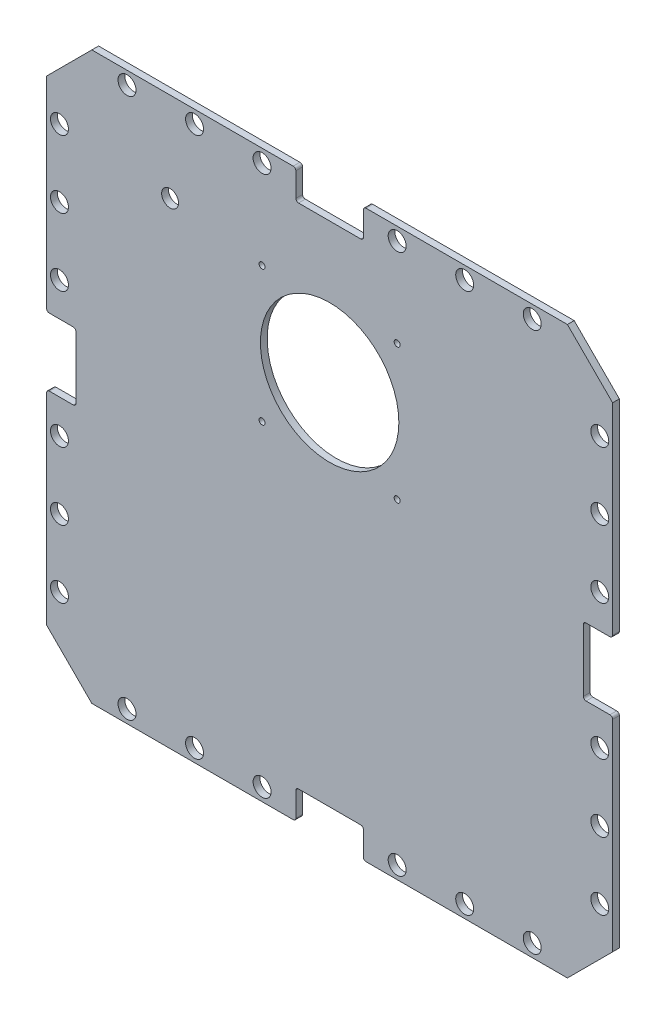
from build123d import *

# Parameters (mm, degrees)
SKETCH1_R             = 3.379999993
SKETCH1_R_2           = 3.379999996
SKETCH1_R_3           = 3.379999998
SKETCH1_R_4           = 1.13
SKETCH1_R_5           = 3.175
SKETCH1_R_6           = 3.38
SKETCH1_R_7           = 26.035
BOSS_EXTRUDE1_DEPTH   = 2.54
F_4_40_TAPPED_HOLE1_D = 2.2606
FILLET1_R             = 1


with BuildPart() as part:
    # Sketch1 → Boss-Extrude1 (new body)
    with BuildSketch(Plane.XY):
        Polygon((93.726, 0), (16.997849999, 0), (0, -16.997849999), (0, -93.726000007), (11, -93.726000007), (11, -119.126000007), (0, -119.126000007), (0, -195.854150007), (16.997849999, -212.852000007), (93.726000007, -212.852000007), (93.726000007, -201.852000007), (119.126000007, -201.852000007), (119.126000007, -212.852000007), (195.854150007, -212.852000007), (212.852000007, -195.854150007), (212.852000007, -119.126), (201.852000007, -119.126), (201.852000007, -93.726), (212.852000007, -93.726), (212.852000007, -16.997849999), (195.854150007, 0), (119.126, 0), (119.126, -11), (93.726, -11), align=None)
        with Locations((30.226, -208.026000005)):
            Circle(SKETCH1_R, mode=Mode.SUBTRACT)
        with Locations((4.825999998, -182.626000003)):
            Circle(SKETCH1_R_2, mode=Mode.SUBTRACT)
        with Locations((55.626, -208.026000005)):
            Circle(SKETCH1_R, mode=Mode.SUBTRACT)
        with Locations((81.026, -208.026000005)):
            Circle(SKETCH1_R, mode=Mode.SUBTRACT)
        with Locations((4.825999998, -157.226000003)):
            Circle(SKETCH1_R_2, mode=Mode.SUBTRACT)
        with Locations((4.825999998, -131.826000003)):
            Circle(SKETCH1_R_2, mode=Mode.SUBTRACT)
        with Locations((131.826, -208.026000005)):
            Circle(SKETCH1_R, mode=Mode.SUBTRACT)
        with Locations((157.226, -208.026000005)):
            Circle(SKETCH1_R, mode=Mode.SUBTRACT)
        with Locations((182.626, -208.026000005)):
            Circle(SKETCH1_R, mode=Mode.SUBTRACT)
        with Locations((208.026000002, -182.626000003)):
            Circle(SKETCH1_R_3, mode=Mode.SUBTRACT)
        with Locations((208.026000002, -157.226000003)):
            Circle(SKETCH1_R_3, mode=Mode.SUBTRACT)
        with Locations((208.026000002, -131.826000003)):
            Circle(SKETCH1_R_3, mode=Mode.SUBTRACT)
        with Locations((4.825999998, -81.026000003)):
            Circle(SKETCH1_R_2, mode=Mode.SUBTRACT)
        with Locations((4.825999998, -55.626000003)):
            Circle(SKETCH1_R_2, mode=Mode.SUBTRACT)
        with Locations((81.026000003, -89.00415)):
            Circle(SKETCH1_R_4, mode=Mode.SUBTRACT)
        with Locations((4.825999998, -30.226000003)):
            Circle(SKETCH1_R_2, mode=Mode.SUBTRACT)
        with Locations((46.426000003, -33.60415)):
            Circle(SKETCH1_R_5, mode=Mode.SUBTRACT)
        with Locations((30.226, -4.826000001)):
            Circle(SKETCH1_R_6, mode=Mode.SUBTRACT)
        with Locations((81.026000003, -38.20415)):
            Circle(SKETCH1_R_4, mode=Mode.SUBTRACT)
        with Locations((55.626, -4.826000001)):
            Circle(SKETCH1_R_6, mode=Mode.SUBTRACT)
        with Locations((81.026, -4.826000001)):
            Circle(SKETCH1_R_6, mode=Mode.SUBTRACT)
        with Locations((131.826000003, -89.00415)):
            Circle(SKETCH1_R_4, mode=Mode.SUBTRACT)
        with Locations((106.426000003, -63.60415)):
            Circle(SKETCH1_R_7, mode=Mode.SUBTRACT)
        with Locations((208.026000002, -81.026000003)):
            Circle(SKETCH1_R_3, mode=Mode.SUBTRACT)
        with Locations((208.026000002, -55.626000003)):
            Circle(SKETCH1_R_3, mode=Mode.SUBTRACT)
        with Locations((131.826000003, -38.20415)):
            Circle(SKETCH1_R_4, mode=Mode.SUBTRACT)
        with Locations((131.826, -4.826000001)):
            Circle(SKETCH1_R_6, mode=Mode.SUBTRACT)
        with Locations((157.226, -4.826000001)):
            Circle(SKETCH1_R_6, mode=Mode.SUBTRACT)
        with Locations((208.026000002, -30.226000003)):
            Circle(SKETCH1_R_3, mode=Mode.SUBTRACT)
        with Locations((182.626, -4.826000001)):
            Circle(SKETCH1_R_6, mode=Mode.SUBTRACT)
    extrude(amount=BOSS_EXTRUDE1_DEPTH)

    # #4-40 Tapped Hole1 (through all)
    with Locations(Plane(origin=(81.026000003, -38.20415, 2.54), x_dir=(1, 0, 0), z_dir=(0, 0, 1))):
        with Locations((0, 0), (50.8, 0), (50.8, -50.8), (0, -50.8)):
            Hole(F_4_40_TAPPED_HOLE1_D / 2)

    # Fillet1
    fillet1_edges = [part.edges().sort_by_distance(p)[0] for p in [
        (0, -93.726000007, 1.27),
        (11, -93.726000007, 1.27),
        (0, -119.126000007, 1.27),
        (11, -119.126000007, 1.27),
        (93.726000007, -212.852000007, 1.27),
        (93.726000007, -201.852000007, 1.27),
        (119.126000007, -212.852000007, 1.27),
        (119.126000007, -201.852000007, 1.27),
        (212.852000007, -119.126, 1.27),
        (201.852000007, -119.126, 1.27),
        (212.852000007, -93.726, 1.27),
        (201.852000007, -93.726, 1.27),
        (119.126, -11, 1.27),
        (119.126, 0, 1.27),
        (93.726, -11, 1.27),
        (93.726, 0, 1.27),
    ]]
    fillet(fillet1_edges, radius=FILLET1_R)


solid = part.part
